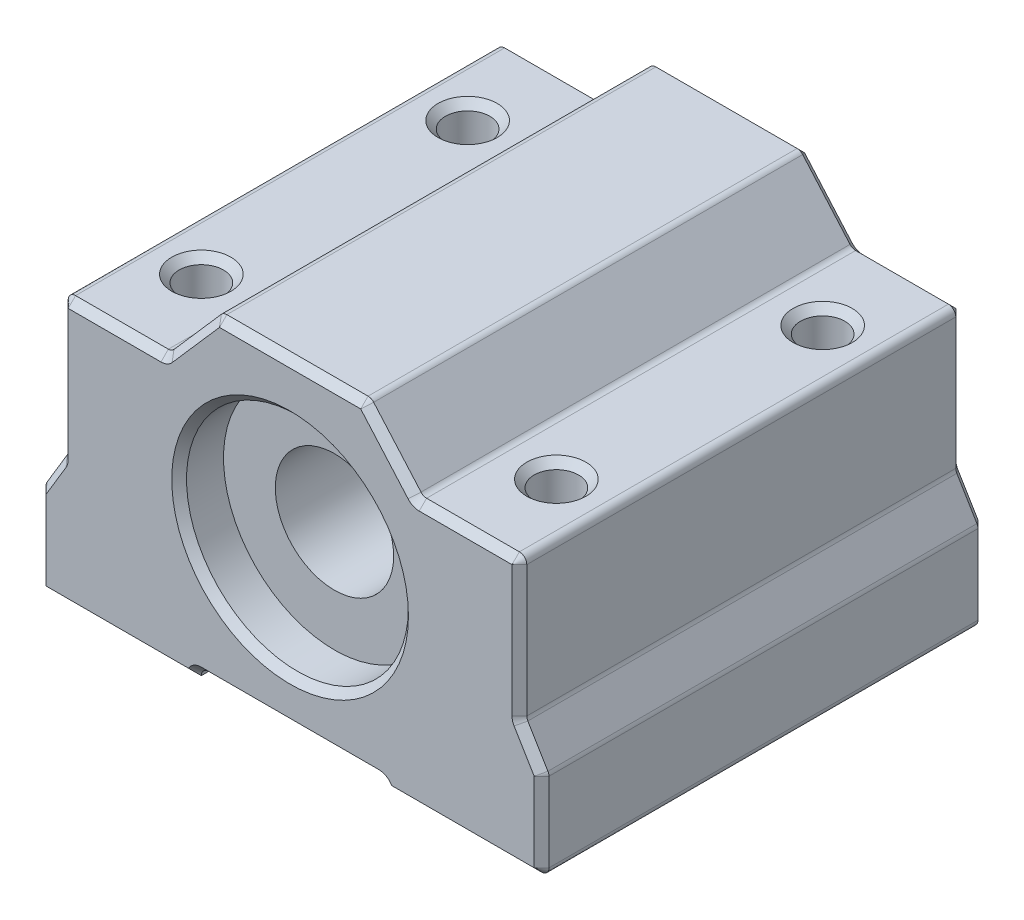
from build123d import *

# Parameters (mm, degrees)
SKETCH2_R           = 7.5
BOSS_EXTRUDE1_DEPTH = 15
SKETCH3_R           = 7.5
SKETCH3_R_2         = 4
BOSS_EXTRUDE2_DEPTH = 12
SKETCH4_R           = 1.5
CUT_EXTRUDE1_DEPTH  = 18
FILLET1_R           = 0.5
CHAMFER1_SIZE       = 0.5


with BuildPart() as part:
    # Sketch2 → Boss-Extrude1 (new, symmetric)
    with BuildSketch(Plane.XY):
        Polygon((5, 11), (-5, 11), (-8.5, 7), (-15.5, 7), (-15.5, -2.5), (-17, -5), (-17, -11), (-6.5, -11), (-6.5, -10.5), (6.5, -10.5), (6.5, -11), (17, -11), (17, -5), (15.5, -2.5), (15.5, 7), (8.5, 7), align=None)
        Circle(SKETCH2_R, mode=Mode.SUBTRACT)
    extrude(amount=BOSS_EXTRUDE1_DEPTH, both=True)

    # Sketch4 → Cut-Extrude1 (cut)
    with BuildSketch(Plane(origin=(0, 7, 0), x_dir=(1, 0, 0), z_dir=(0, 1, 0))):
        with Locations(Location((-12, 9, 0), (0, 0, 270))):
            Circle(SKETCH4_R)
        with Locations(Location((12, 9, 0), (0, 0, 270))):
            Circle(SKETCH4_R)
        with Locations(Location((-12, -9, 0), (0, 0, 270))):
            Circle(SKETCH4_R)
        with Locations(Location((12, -9, 0), (0, 0, 270))):
            Circle(SKETCH4_R)
    extrude(amount=-CUT_EXTRUDE1_DEPTH, mode=Mode.SUBTRACT)

    # Fillet1
    fillet1_edges = [part.edges().sort_by_distance(p)[0] for p in [
        (6.5, -10.5, 0),
        (-6.5, -10.5, 0),
        (-17, -11, 0),
        (-17, -5, 0),
        (-15.5, -2.5, 0),
        (-15.5, 7, 0),
        (-8.5, 7, 0),
        (-5, 11, 0),
        (5, 11, 0),
        (8.5, 7, 0),
        (17, -11, 0),
        (17, -5, 0),
        (15.5, -2.5, 0),
        (15.5, 7, 0),
    ]]
    fillet(fillet1_edges, radius=FILLET1_R - 0.0001)  # a hair under: the kernel refuses the full size

    # Chamfer1
    chamfer1_edges = [part.edges().sort_by_distance(p)[0] for p in [
        (12, 7, 7.5),
    ]]
    chamfer(chamfer1_edges, length=CHAMFER1_SIZE)
    chamfer1_2_edges = [part.edges().sort_by_distance(p)[0] for p in [
        (12, -11, 7.5),
    ]]
    chamfer(chamfer1_2_edges, length=CHAMFER1_SIZE)
    chamfer1_3_edges = [part.edges().sort_by_distance(p)[0] for p in [
        (12, 7, -10.5),
    ]]
    chamfer(chamfer1_3_edges, length=CHAMFER1_SIZE)
    chamfer1_4_edges = [part.edges().sort_by_distance(p)[0] for p in [
        (-12, 7, -10.5),
    ]]
    chamfer(chamfer1_4_edges, length=CHAMFER1_SIZE)
    chamfer1_5_edges = [part.edges().sort_by_distance(p)[0] for p in [
        (-12, 7, 7.5),
    ]]
    chamfer(chamfer1_5_edges, length=CHAMFER1_SIZE)
    chamfer1_6_edges = [part.edges().sort_by_distance(p)[0] for p in [
        (12, -11, -10.5),
    ]]
    chamfer(chamfer1_6_edges, length=CHAMFER1_SIZE)
    chamfer1_7_edges = [part.edges().sort_by_distance(p)[0] for p in [
        (-12, -11, -10.5),
    ]]
    chamfer(chamfer1_7_edges, length=CHAMFER1_SIZE)
    chamfer1_8_edges = [part.edges().sort_by_distance(p)[0] for p in [
        (-12, -11, 7.5),
    ]]
    chamfer(chamfer1_8_edges, length=CHAMFER1_SIZE)
    chamfer1_9_edges = [part.edges().sort_by_distance(p)[0] for p in [
        (6.5, -10.99995, -15),
        (-6.5, -10.99995, -15),
        (6.35358268, -10.64641732, -15),
        (-6.35358268, -10.64641732, -15),
        (0, -10.5, -15),
    ]]
    chamfer(chamfer1_9_edges, length=CHAMFER1_SIZE)
    chamfer1_10_edges = [part.edges().sort_by_distance(p)[0] for p in [
        (6.5, -10.99995, 15),
        (-6.5, -10.99995, 15),
        (6.35358268, -10.64641732, 15),
        (-6.35358268, -10.64641732, 15),
        (0, -10.5, 15),
    ]]
    chamfer(chamfer1_10_edges, length=CHAMFER1_SIZE)
    chamfer1_11_edges = [part.edges().sort_by_distance(p)[0] for p in [
        (-7.5, 0, -15),
    ]]
    chamfer(chamfer1_11_edges, length=CHAMFER1_SIZE)
    chamfer1_12_edges = [part.edges().sort_by_distance(p)[0] for p in [
        (-7.5, 0, 15),
    ]]
    chamfer(chamfer1_12_edges, length=CHAMFER1_SIZE)
    chamfer1_13_edges = [part.edges().sort_by_distance(p)[0] for p in [
        (0, 11, -15),
        (4.979728083, 10.955325394, -15),
        (-4.979728083, 10.955325394, -15),
        (6.75, 9, -15),
        (-6.75, 9, -15),
        (8.520271917, 7.044674606, -15),
        (-8.520271917, 7.044674606, -15),
        (11.863469368, 7, -15),
        (-11.863469368, 7, -15),
        (15.35358268, 6.85358268, -15),
        (-15.35358268, 6.85358268, -15),
        (15.5, 2.069282142, -15),
        (-15.5, 2.069282142, -15),
        (15.518138907, -2.494975814, -15),
        (-15.518138907, -2.494975814, -15),
        (16.25, -3.75, -15),
        (-16.25, -3.75, -15),
        (16.981861093, -5.005024186, -15),
        (-16.981861093, -5.005024186, -15),
        (17, -7.819282142, -15),
        (-17, -7.819282142, -15),
        (16.85358268, -10.85358268, -15),
        (-16.85358268, -10.85358268, -15),
        (11.75005, -11, -15),
        (-11.75005, -11, -15),
    ]]
    chamfer(chamfer1_13_edges, length=CHAMFER1_SIZE - 0.0004)  # a hair under: the kernel refuses the full size
    chamfer1_14_edges = [part.edges().sort_by_distance(p)[0] for p in [
        (0, 11, 15),
        (4.979728083, 10.955325394, 15),
        (-4.979728083, 10.955325394, 15),
        (6.75, 9, 15),
        (-6.75, 9, 15),
        (8.520271917, 7.044674606, 15),
        (-8.520271917, 7.044674606, 15),
        (11.863469368, 7, 15),
        (-11.863469368, 7, 15),
        (15.35358268, 6.85358268, 15),
        (-15.35358268, 6.85358268, 15),
        (15.5, 2.069282142, 15),
        (-15.5, 2.069282142, 15),
        (15.518138907, -2.494975814, 15),
        (-15.518138907, -2.494975814, 15),
        (16.25, -3.75, 15),
        (-16.25, -3.75, 15),
        (16.981861093, -5.005024186, 15),
        (-16.981861093, -5.005024186, 15),
        (17, -7.819282142, 15),
        (-17, -7.819282142, 15),
        (16.85358268, -10.85358268, 15),
        (-16.85358268, -10.85358268, 15),
        (11.75005, -11, 15),
        (-11.75005, -11, 15),
    ]]
    chamfer(chamfer1_14_edges, length=CHAMFER1_SIZE - 0.0004)  # a hair under: the kernel refuses the full size


with BuildPart() as body_2:
    # Sketch3 → Boss-Extrude2 (new, symmetric)
    with BuildSketch(Plane.XY):
        Circle(SKETCH3_R)
        Circle(SKETCH3_R_2, mode=Mode.SUBTRACT)
    extrude(amount=BOSS_EXTRUDE2_DEPTH, both=True)


solid = Compound([part.part, body_2.part])
